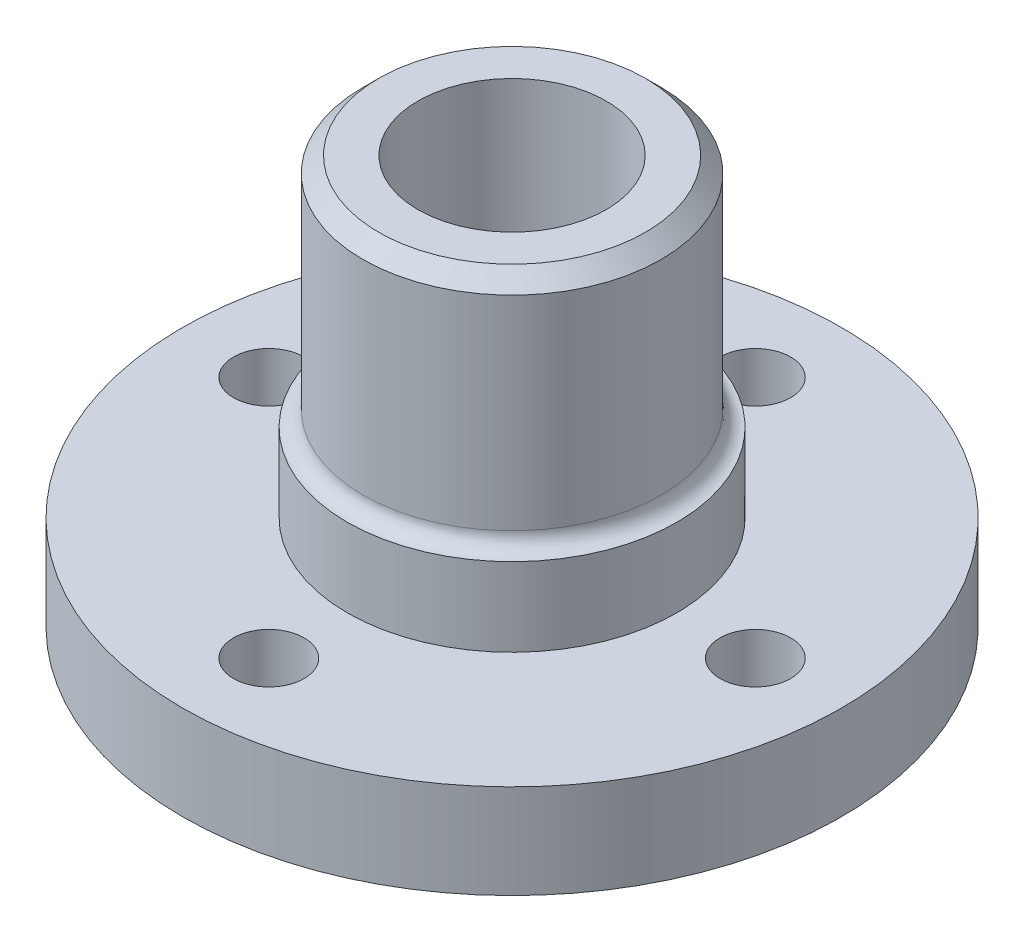
from build123d import *

# Parameters (mm, degrees)
RACCORDO1_R              = 1
SMUSSO1_SIZE             = 1
RACCORDO2_R              = 1
TAGLIO_ESTRUSIONE1_DEPTH = 36.80502758


with BuildPart() as part:
    # Schizzo1 → Rivoluzione1 (revolve)
    with BuildSketch(Plane.XY, mode=Mode.PRIVATE) as rivoluzione1_sk:
        Polygon((10.5, 7), (21, 7), (21, 1), (10, 1), (10, 0), (6, 0), (6, 27), (9.5, 27), (9.5, 12), (10.5, 12), align=None)
    revolve(rivoluzione1_sk.sketch.rotate(Axis((0, 27, 0), (0, -1, 0)), 90), axis=Axis((0, 27, 0), (0, -1, 0)))

    # Raccordo1
    raccordo1_edges = [part.edges().sort_by_distance(p)[0] for p in [
        (0, 12, -9.5),
    ]]
    fillet(raccordo1_edges, radius=RACCORDO1_R - 0.0001)  # a hair under: the kernel refuses the full size

    # Smusso1
    smusso1_edges = [part.edges().sort_by_distance(p)[0] for p in [
        (0, 27, -9.5),
    ]]
    chamfer(smusso1_edges, length=SMUSSO1_SIZE)

    # Raccordo2
    raccordo2_edges = [part.edges().sort_by_distance(p)[0] for p in [
        (0, 1, -10),
    ]]
    fillet(raccordo2_edges, radius=RACCORDO2_R - 0.0001)  # a hair under: the kernel refuses the full size

    # Schizzo2 → Taglio-Estrusione1 (cut, through all)
    with BuildSketch(Plane(origin=(0, 7, 0), x_dir=(1, 0, 0), z_dir=(0, 1, 0))):
        with BuildLine():
            ThreePointArc((2.25, 15.5), (1.590990258, 17.090990258), (0, 17.75))
            Line((0, 17.75), (0, 13.25))
            ThreePointArc((0, 13.25), (1.590990258, 13.909009742), (2.25, 15.5))
        make_face()
        with BuildLine():
            Line((0, 13.25), (0, 17.75))
            ThreePointArc((0, 17.75), (-2.25, 15.5), (0, 13.25))
        make_face()
        with BuildLine():
            ThreePointArc((17.75, 0), (15.5, 2.25), (13.25, 0))
            Line((13.25, 0), (17.75, 0))
        make_face()
        with BuildLine():
            Line((17.75, 0), (13.25, 0))
            ThreePointArc((13.25, 0), (15.5, -2.25), (17.75, 0))
        make_face()
        with BuildLine():
            ThreePointArc((2.25, -15.5), (1.590990258, -13.909009742), (0, -13.25))
            Line((0, -13.25), (0, -17.75))
            ThreePointArc((0, -17.75), (1.590990258, -17.090990258), (2.25, -15.5))
        make_face()
        with BuildLine():
            Line((0, -17.75), (0, -13.25))
            ThreePointArc((0, -13.25), (-2.25, -15.5), (0, -17.75))
        make_face()
        with BuildLine():
            ThreePointArc((-17.75, 0), (-15.5, -2.25), (-13.25, 0))
            Line((-13.25, 0), (-17.75, 0))
        make_face()
        with BuildLine():
            Line((-17.75, 0), (-13.25, 0))
            ThreePointArc((-13.25, 0), (-15.5, 2.25), (-17.75, 0))
        make_face()
    extrude(amount=-TAGLIO_ESTRUSIONE1_DEPTH, mode=Mode.SUBTRACT)


solid = part.part
